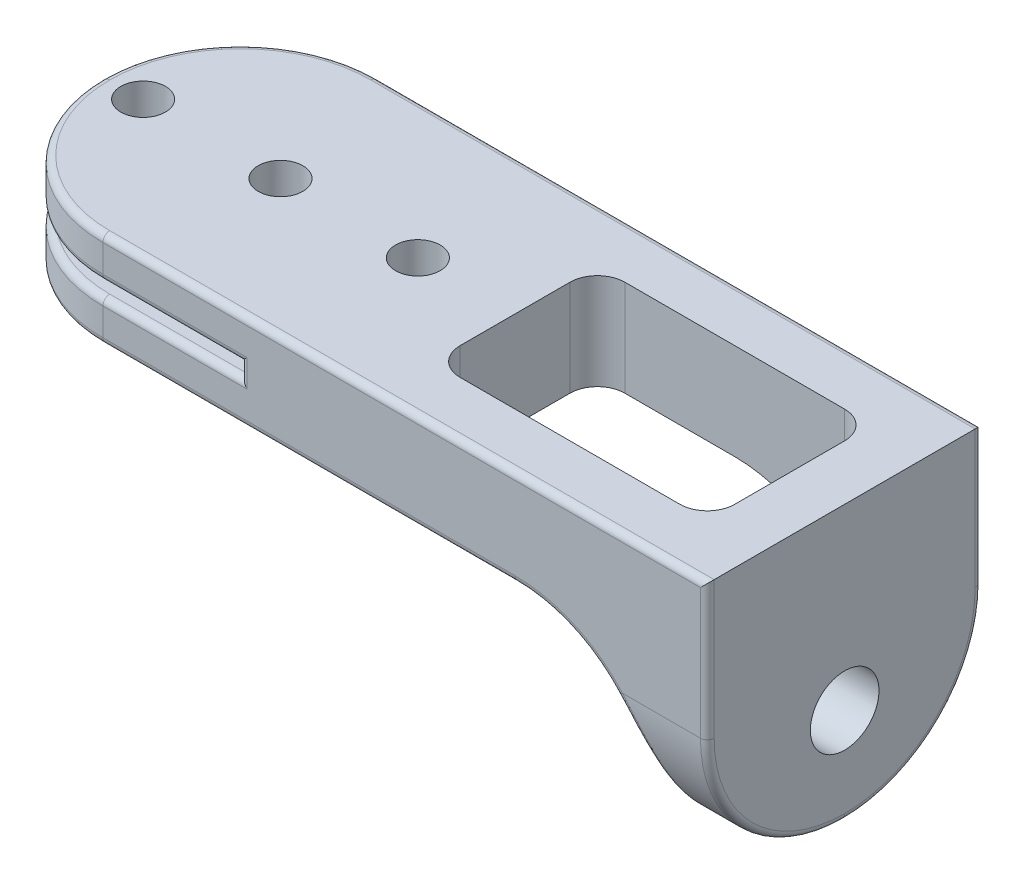
from build123d import *

# Parameters (mm, degrees)
BOSS_EXTRUDE1_DEPTH     = 10
FILLET1_R               = 10
CUT_EXTRUDE1_DEPTH      = 59.446556785
CUT_EXTRUDE1_DEPTH_BACK = 59.446556785
SKETCH3_R               = 1.625
FILLET2_R               = 10
SKETCH4_R               = 2.5
CUT_EXTRUDE2_DEPTH      = 55.772255751
SKETCH5_W               = 20
SKETCH5_H               = 12
CUT_EXTRUDE3_DEPTH      = 59.446556785
FILLET3_R               = 10
FILLET5_R               = 0.5
FILLET6_R               = 2


with BuildPart() as part:
    # Sketch1 → Boss-Extrude1 (new, symmetric)
    with BuildSketch(Plane.XY):
        Polygon((0, 0), (0, -20), (-4, -20), (-4, -7), (-54, -7), (-54, -4), (-34, -4), (-34, -3), (-54, -3), (-54, 0), align=None)
    extrude(amount=BOSS_EXTRUDE1_DEPTH, both=True)

    # Fillet1
    fillet1_edges = [part.edges().sort_by_distance(p)[0] for p in [
        (-54, -5.5, -10),
        (-54, -1.5, -10),
        (-54, -5.5, 10),
        (-54, -1.5, 10),
    ]]
    fillet(fillet1_edges, radius=FILLET1_R - 0.0001)  # a hair under: the kernel refuses the full size

    # Sketch3 → Cut-Extrude1 (cut, two sides: drawn at the far end of the back side and taken through both)
    with BuildSketch(Plane(origin=(0, 0, 0), x_dir=(1, 0, 0), z_dir=(0, 1, 0)).offset(-CUT_EXTRUDE1_DEPTH_BACK)):
        with Locations(Location((-51.071067812, 0, 0), (0, 0, 180))):
            Circle(SKETCH3_R)
        with Locations(Location((-41.071067812, 0, 0), (0, 0, 180))):
            Circle(SKETCH3_R)
        with Locations(Location((-31.071067812, 0, 0), (0, 0, 180))):
            Circle(SKETCH3_R)
    extrude(amount=CUT_EXTRUDE1_DEPTH + CUT_EXTRUDE1_DEPTH_BACK, mode=Mode.SUBTRACT)

    # Fillet2
    fillet2_edges = [part.edges().sort_by_distance(p)[0] for p in [
        (-2, -20, 10),
        (-2, -20, -10),
    ]]
    fillet(fillet2_edges, radius=FILLET2_R - 0.0001)  # a hair under: the kernel refuses the full size

    # Sketch4 → Cut-Extrude2 (cut, through all)
    with BuildSketch(Plane.ZY.offset(4)):
        with Locations((0, -13)):
            Circle(SKETCH4_R)
    extrude(amount=-CUT_EXTRUDE2_DEPTH, mode=Mode.SUBTRACT)

    # Sketch5 → Cut-Extrude3 (cut, through all)
    with BuildSketch(Plane(origin=(0, 0, 0), x_dir=(1, 0, 0), z_dir=(0, 1, 0))):
        with Locations((-14, 0)):
            Rectangle(SKETCH5_W, SKETCH5_H)
    extrude(amount=-CUT_EXTRUDE3_DEPTH, mode=Mode.SUBTRACT)

    # Fillet3
    fillet3_edges = [part.edges().sort_by_distance(p)[0] for p in [
        (-4, -7, -8),
        (-4, -7, 8),
    ]]
    fillet(fillet3_edges, radius=FILLET3_R)

    # Fillet5
    fillet5_edges = [part.edges().sort_by_distance(p)[0] for p in [
        (-4, -19.219544127, -3.873063981),
        (-4.63248147, -13.50005763, -9.367506076),
        (-10.126952105, -7.780482659, -10),
        (-10.126952105, -7.780482659, 10),
        (-4.63248147, -13.50005763, 9.367506076),
        (-39.00005, -4, -10),
        (-22.00005, 0, -10),
        (-34, -3.5, 10),
        (-39.00005, -4, 10),
        (-29.00005, -7, -10),
        (-29.00005, -7, 10),
        (-51.071097101, -7, 7.071097101),
        (-51.071097101, -7, -7.071097101),
        (-39.00005, -3, -10),
        (-51.071097101, -4, 7.071097101),
        (-51.071097101, -4, -7.071097101),
        (-39.00005, -3, 10),
        (-51.071097101, -3, 7.071097101),
        (-51.071097101, -3, -7.071097101),
        (-51.071097101, 0, 7.071097101),
        (-51.071097101, 0, -7.071097101),
        (-22.00005, 0, 10),
        (0, -5.00005, 10),
        (0, -5.00005, -10),
        (0, -17.071097101, -7.071097101),
        (0, -17.071097101, 7.071097101),
        (-4, -19.219544127, 3.873063981),
    ]]
    fillet(fillet5_edges, radius=FILLET5_R)

    # Fillet6
    fillet6_edges = [part.edges().sort_by_distance(p)[0] for p in [
        (-24, -3.5, 6),
        (-4, -8.5, 6),
        (-24, -3.5, -6),
        (-4, -8.5, -6),
    ]]
    fillet(fillet6_edges, radius=FILLET6_R)


solid = part.part
